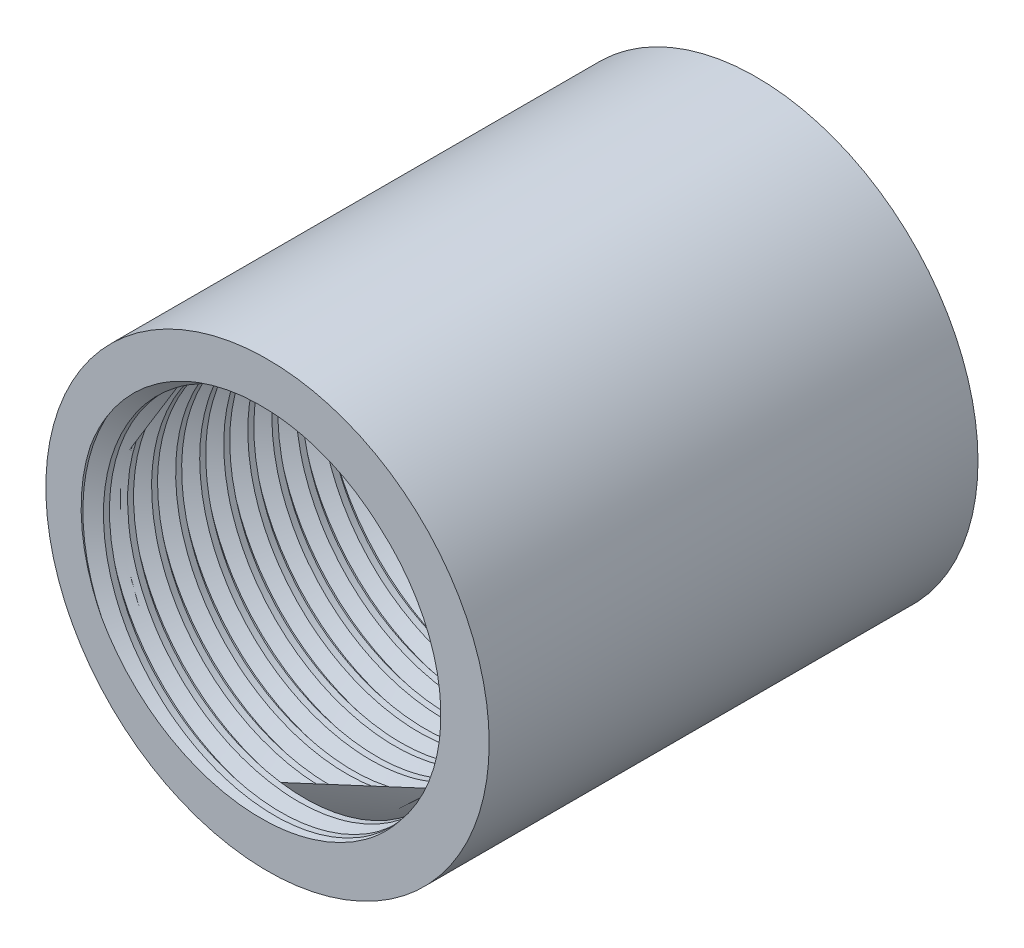
from build123d import *

# Parameters (mm, degrees)
SZKIC1_R                    = 19.5
SZKIC1_R_2                  = 15.25
DODANIE_WYCI_GNI_CIE1_DEPTH = 43
GWINT1_PITCH                = 2.116666667


with BuildPart() as part:
    # Szkic1 → Dodanie-wyciągnięcie1 (new body)
    with BuildSketch(Plane.XY):
        Circle(SZKIC1_R)
        Circle(SZKIC1_R_2, mode=Mode.SUBTRACT)
    extrude(amount=DODANIE_WYCI_GNI_CIE1_DEPTH)

    # Gwint1: the profile of Profil gwintu1 profile screwed along a right-hand helix of 22.677165 turns, 10 arcs to a turn; built about Z, then put on its axis
    gwint1_z = Axis((0, 0, 0), (0, 0, 1))
    gwint1_corners = [(15.2497, 0, -0.000173205), (16.395679435, 0, 0.66145833), (16.395679435, 0, 0.926041664), (15.2497, 0, 1.587673199)]
    with BuildLine(mode=Mode.PRIVATE) as gwint1_profile:
        Line(gwint1_corners[0], gwint1_corners[1])
        Line(gwint1_corners[1], gwint1_corners[2])
        Line(gwint1_corners[2], gwint1_corners[3])
        Line(gwint1_corners[3], gwint1_corners[0])
    gwint1_cap = Face(gwint1_profile.wire())
    gwint1_turn_angles = [0, 18, 36, 54, 72, 90, 108, 126, 144, 162, 180, 198, 216, 234, 252, 270, 288, 306, 324, 342, 360]
    gwint1_turn_weights = [1, 0.9510565162951535, 1, 0.9510565162951535, 1, 0.9510565162951535, 1, 0.9510565162951535, 1, 0.9510565162951535, 1, 0.9510565162951535, 1, 0.9510565162951535, 1, 0.9510565162951535, 1, 0.9510565162951535, 1, 0.9510565162951535, 1]
    gwint1_turn_rails = [Edge.make_bspline([Vector(p[0], p[1], 0).rotate(gwint1_z, gwint1_turn_angles[k]) / gwint1_turn_weights[k] + Vector(0, 0, p[2] + GWINT1_PITCH * gwint1_turn_angles[k] / 360) for k in range(21)], [0, 0, 0, 1, 1, 2, 2, 3, 3, 4, 4, 5, 5, 6, 6, 7, 7, 8, 8, 9, 9, 10, 10, 10], 2, gwint1_turn_weights) for p in gwint1_corners]
    gwint1_turn_sides = [Face.make_surface_from_curves(gwint1_turn_rails[p[0]], gwint1_turn_rails[p[1]]) for p in [(0, 1), (1, 2), (2, 3), (3, 0)]]
    gwint1_last_angles = [7920, 7938, 7956, 7974, 7992, 8010, 8028, 8046, 8064, 8082, 8100, 8118, 8136, 8149.88976378, 8163.779527559]
    gwint1_last_weights = [1, 0.9510565162951535, 1, 0.9510565162951535, 1, 0.9510565162951535, 1, 0.9510565162951535, 1, 0.9510565162951535, 1, 0.9510565162951535, 1, 0.9707593842075066, 1]
    gwint1_last_rails = [Edge.make_bspline([Vector(p[0], p[1], 0).rotate(gwint1_z, gwint1_last_angles[k]) / gwint1_last_weights[k] + Vector(0, 0, p[2] + GWINT1_PITCH * gwint1_last_angles[k] / 360) for k in range(15)], [0, 0, 0, 1, 1, 2, 2, 3, 3, 4, 4, 5, 5, 6, 6, 7, 7, 7], 2, gwint1_last_weights) for p in gwint1_corners]
    gwint1_last_sides = [Face.make_surface_from_curves(gwint1_last_rails[p[0]], gwint1_last_rails[p[1]]) for p in [(0, 1), (1, 2), (2, 3), (3, 0)]]
    gwint1 = Plane(origin=(0, 0, 48), x_dir=(-1, 0, 0), z_dir=(0, 0, -1)) * Solid(Shell([*[p.moved(Location((0, 0, GWINT1_PITCH * i))) for i in range(22) for p in gwint1_turn_sides], *gwint1_last_sides, gwint1_cap, gwint1_cap.rotate(gwint1_z, 8163.779527559).moved(Location((0, 0, GWINT1_PITCH * 8163.779527559 / 360)))]))
    add(gwint1, mode=Mode.SUBTRACT)


solid = part.part
